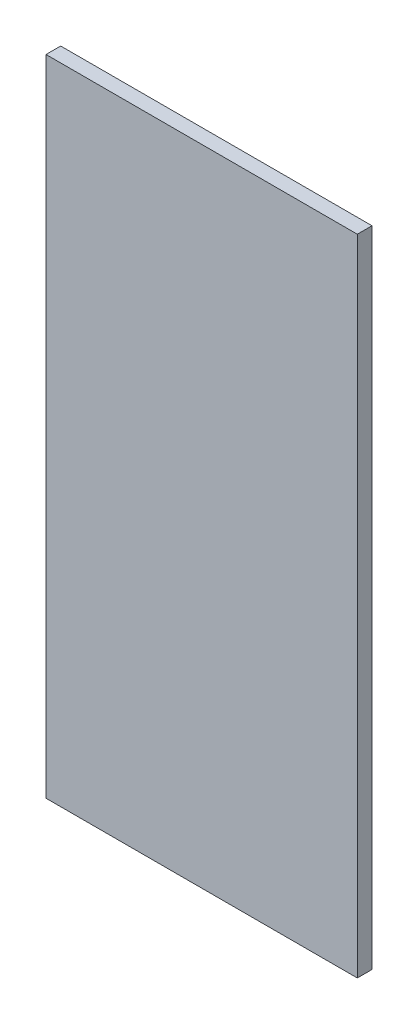
from build123d import *

# Parameters (mm, degrees)
TABAN_FLAN_1_DEPTH         = 15
KES_EKSTR_ZYON1_DEPTH      = 2129.448495971
KES_EKSTR_ZYON1_DEPTH_BACK = 2129.448495971
IZIM3_W                    = 642
IZIM3_H                    = 505
KES_EKSTR_ZYON2_DEPTH      = 1807.166658977
KES_EKSTR_ZYON2_DEPTH_BACK = 1807.166658977
IZIM4_W                    = 37
IZIM4_H                    = 345
IZIM4_W_2                  = 7
IZIM4_H_2                  = 658
KES_EKSTR_ZYON3_DEPTH      = 1113.563706041
KES_EKSTR_ZYON3_DEPTH_BACK = 1113.563706041
IZIM5_W                    = 572
IZIM5_H                    = 658


# Sheet-metal steps are written as plain solids
with BuildPart() as part:
    # Çizim1 → Taban-Flanş1 (new body)
    with BuildSketch(Plane.XY):
        Polygon((0, 0), (1502, 0), (1502, 1508), (860, 1508), (860, 658), (0, 658), align=None)
    extrude(amount=-TABAN_FLAN_1_DEPTH)

    # Çizim3 → Kes-Ekstrüzyon1 (cut, two sides: drawn at the far end of the back side and taken through both)
    with BuildSketch(Plane.XY.offset(-KES_EKSTR_ZYON1_DEPTH_BACK)):
        with Locations((1181, 1255.5)):
            Rectangle(IZIM3_W, IZIM3_H)
    extrude(amount=KES_EKSTR_ZYON1_DEPTH + KES_EKSTR_ZYON1_DEPTH_BACK, mode=Mode.SUBTRACT)

    # Çizim4 → Kes-Ekstrüzyon2 (cut, two sides: drawn at the far end of the back side and taken through both)
    with BuildSketch(Plane.XY.offset(-KES_EKSTR_ZYON2_DEPTH_BACK)):
        Polygon((1502, 0), (1502, 1003), (897, 1003), (897, 658), (897, 0), align=None)
        with Locations((878.5, 830.5)):
            Rectangle(IZIM4_W, IZIM4_H)
        with Locations((3.5, 329)):
            Rectangle(IZIM4_W_2, IZIM4_H_2)
    extrude(amount=KES_EKSTR_ZYON2_DEPTH + KES_EKSTR_ZYON2_DEPTH_BACK, mode=Mode.SUBTRACT)

    # Çizim5 → Kes-Ekstrüzyon3 (cut, two sides: drawn at the far end of the back side and taken through both)
    with BuildSketch(Plane.XY.offset(-KES_EKSTR_ZYON3_DEPTH_BACK)):
        with Locations((293, 329)):
            Rectangle(IZIM5_W, IZIM5_H)
    extrude(amount=KES_EKSTR_ZYON3_DEPTH + KES_EKSTR_ZYON3_DEPTH_BACK, mode=Mode.SUBTRACT)


solid = part.part
